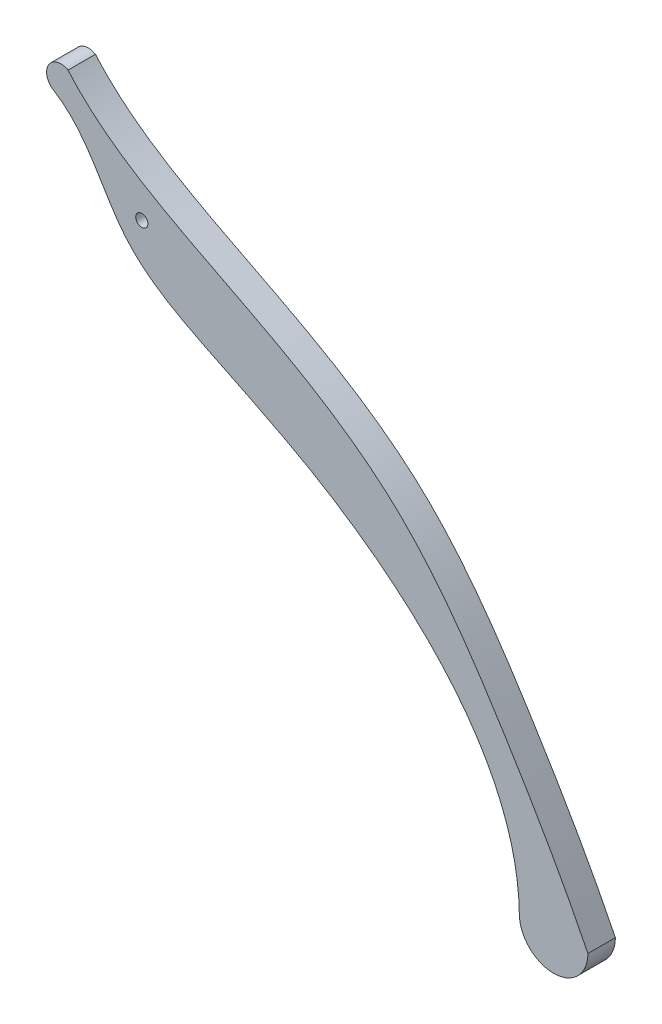
from build123d import *

# Parameters (mm, degrees)
ESQUISSE1_R        = 2.65
BOSS_EXTRU_1_DEPTH = 12


with BuildPart() as part:
    # Esquisse1 → Boss.-Extru.1 (new body)
    with BuildSketch(Plane.XY):
        with BuildLine():
            ThreePointArc((165, -180), (180, -195), (195, -180))
            add(Edge.make_bspline(
                [(-32.230339059, 40.767997833), (-21.487067244, 28.285755558), (6.817422192, 8.985627157), (57.907646488, -15.335442256), (116.000678334, -50.549955104), (158.250235065, -113.410127761), (183.811606987, -157.342321495), (195, -180)],
                knots=[0, 0, 0, 0, 0.150864181, 0.31367633, 0.525224537, 0.76791969, 1, 1, 1, 1], degree=3))
            ThreePointArc((-32.230339059, 40.767997833), (-40.767997833, 38.480339059), (-38.480339059, 29.942680286))
            add(Edge.make_bspline(
                [(-38.480339059, 29.942680286), (-23.002764448, 20.39549149), (-12.930611069, -13.40802616), (30.61910813, -35.684443637), (67.125577735, -53.009535423), (125.38490205, -89.835440377), (164.480714333, -135.223470247), (165, -180)],
                knots=[0, 0, 0, 0, 0.172045966, 0.317202957, 0.46233432, 0.575673221, 1, 1, 1, 1], degree=3))
        make_face()
        Circle(ESQUISSE1_R, mode=Mode.SUBTRACT)
    extrude(amount=BOSS_EXTRU_1_DEPTH)


solid = part.part
